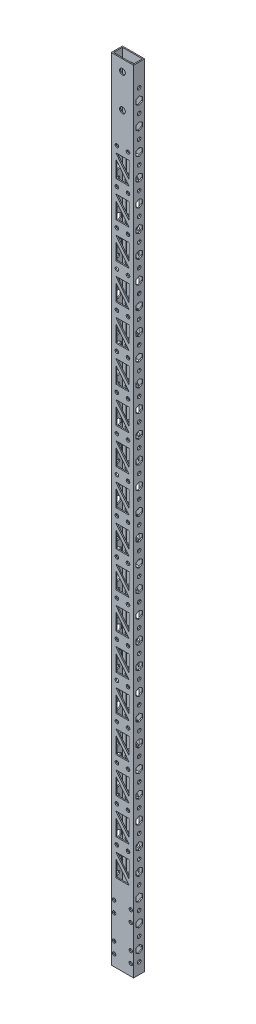
from build123d import *

# Parameters (mm, degrees)
SKETCH_1_W          = 20
SKETCH_1_H          = 10
SKETCH_1_W_2        = 18
SKETCH_1_H_2        = 8
EXTRUDE_1_DEPTH     = 710
SKETCH_2_R          = 1.55
SKETCH_2_R_2        = 2.6
CUT_EXTRUDE_1_DEPTH = 711.140831103
SKETCH_3_R          = 1.6
CUT_EXTRUDE_2_DEPTH = 711.299232718
SKETCH_6_R          = 1.6
CUT_EXTRUDE_4_DEPTH = 711.140831106


with BuildPart() as part:
    # 草图1 → 拉伸-薄壁1 (new body)
    with BuildSketch(Plane(origin=(0, 0, 0), x_dir=(1, 0, 0), z_dir=(0, 1, 0))):
        Rectangle(SKETCH_1_W, SKETCH_1_H)
        Rectangle(SKETCH_1_W_2, SKETCH_1_H_2, mode=Mode.SUBTRACT)
    extrude(amount=EXTRUDE_1_DEPTH)

    # 草图2 → 切除-拉伸1 (cut, through all)
    with BuildSketch(Plane(origin=(0, 0, -5), x_dir=(-1, 0, 0), z_dir=(0, 0, -1))):
        with Locations((-7.5, 20)):
            Circle(SKETCH_2_R)
        with Locations((-7.5, 10)):
            Circle(SKETCH_2_R)
        with Locations((7.5, 10)):
            Circle(SKETCH_2_R)
        with Locations((7.5, 20)):
            Circle(SKETCH_2_R)
        with Locations((-7.5, 51.9)):
            Circle(SKETCH_2_R)
        with Locations((-7.5, 41.9)):
            Circle(SKETCH_2_R)
        with Locations((7.5, 41.9)):
            Circle(SKETCH_2_R)
        with Locations((7.5, 51.9)):
            Circle(SKETCH_2_R)
        with Locations((0, 700)):
            Circle(SKETCH_2_R_2)
        with Locations((0, 670)):
            Circle(SKETCH_2_R_2)
    extrude(amount=-CUT_EXTRUDE_1_DEPTH, mode=Mode.SUBTRACT)

    # 草图3 → 切除-拉伸2 (cut, through all)
    with BuildSketch(Plane.ZY.offset(10)):
        with Locations((0, 10)):
            Circle(SKETCH_3_R)
        with Locations((0, 30)):
            Circle(SKETCH_3_R)
        with Locations((0, 50)):
            Circle(SKETCH_3_R)
        with Locations((0, 70)):
            Circle(SKETCH_3_R)
        with Locations((0, 90)):
            Circle(SKETCH_3_R)
        with Locations((0, 110)):
            Circle(SKETCH_3_R)
        with Locations((0, 130)):
            Circle(SKETCH_3_R)
        with Locations((0, 150)):
            Circle(SKETCH_3_R)
        with Locations((0, 170)):
            Circle(SKETCH_3_R)
        with Locations((0, 190)):
            Circle(SKETCH_3_R)
        with Locations((0, 210)):
            Circle(SKETCH_3_R)
        with Locations((0, 230)):
            Circle(SKETCH_3_R)
        with Locations((0, 250)):
            Circle(SKETCH_3_R)
        with Locations((0, 270)):
            Circle(SKETCH_3_R)
        with Locations((0, 290)):
            Circle(SKETCH_3_R)
        with Locations((0, 310)):
            Circle(SKETCH_3_R)
        with Locations((0, 330)):
            Circle(SKETCH_3_R)
        with Locations((0, 350)):
            Circle(SKETCH_3_R)
        with Locations((0, 370)):
            Circle(SKETCH_3_R)
        with Locations((0, 390)):
            Circle(SKETCH_3_R)
        with Locations((0, 410)):
            Circle(SKETCH_3_R)
        with Locations((0, 430)):
            Circle(SKETCH_3_R)
        with Locations((0, 450)):
            Circle(SKETCH_3_R)
        with Locations((0, 470)):
            Circle(SKETCH_3_R)
        with Locations((0, 490)):
            Circle(SKETCH_3_R)
        with Locations((0, 510)):
            Circle(SKETCH_3_R)
        with Locations((0, 530)):
            Circle(SKETCH_3_R)
        with Locations((0, 550)):
            Circle(SKETCH_3_R)
        with Locations((0, 570)):
            Circle(SKETCH_3_R)
        with Locations((0, 590)):
            Circle(SKETCH_3_R)
        with Locations((0, 610)):
            Circle(SKETCH_3_R)
        with Locations((0, 630)):
            Circle(SKETCH_3_R)
        with Locations((0, 650)):
            Circle(SKETCH_3_R)
        with Locations((0, 670)):
            Circle(SKETCH_3_R)
        with Locations((0, 690)):
            Circle(SKETCH_3_R)
        Polygon((-3.031088913, 681.75), (-3.031088913, 678.25), (0, 676.5), (3.031088913, 678.25), (3.031088913, 681.75), (0, 683.5), align=None)
        Polygon((3.031088913, 661.75), (0, 663.5), (-3.031088913, 661.75), (-3.031088913, 658.25), (0, 656.5), (3.031088913, 658.25), align=None)
        Polygon((3.031088913, 641.75), (0, 643.5), (-3.031088913, 641.75), (-3.031088913, 638.25), (0, 636.5), (3.031088913, 638.25), align=None)
        Polygon((3.031088913, 621.75), (0, 623.5), (-3.031088913, 621.75), (-3.031088913, 618.25), (0, 616.5), (3.031088913, 618.25), align=None)
        Polygon((3.031088913, 601.75), (0, 603.5), (-3.031088913, 601.75), (-3.031088913, 598.25), (0, 596.5), (3.031088913, 598.25), align=None)
        Polygon((3.031088913, 581.75), (0, 583.5), (-3.031088913, 581.75), (-3.031088913, 578.25), (0, 576.5), (3.031088913, 578.25), align=None)
        Polygon((3.031088913, 561.75), (0, 563.5), (-3.031088913, 561.75), (-3.031088913, 558.25), (0, 556.5), (3.031088913, 558.25), align=None)
        Polygon((3.031088913, 541.75), (0, 543.5), (-3.031088913, 541.75), (-3.031088913, 538.25), (0, 536.5), (3.031088913, 538.25), align=None)
        Polygon((3.031088913, 521.75), (0, 523.5), (-3.031088913, 521.75), (-3.031088913, 518.25), (0, 516.5), (3.031088913, 518.25), align=None)
        Polygon((3.031088913, 501.75), (0, 503.5), (-3.031088913, 501.75), (-3.031088913, 498.25), (0, 496.5), (3.031088913, 498.25), align=None)
        Polygon((3.031088913, 481.75), (0, 483.5), (-3.031088913, 481.75), (-3.031088913, 478.25), (0, 476.5), (3.031088913, 478.25), align=None)
        Polygon((3.031088913, 461.75), (0, 463.5), (-3.031088913, 461.75), (-3.031088913, 458.25), (0, 456.5), (3.031088913, 458.25), align=None)
        Polygon((3.031088913, 441.75), (0, 443.5), (-3.031088913, 441.75), (-3.031088913, 438.25), (0, 436.5), (3.031088913, 438.25), align=None)
        Polygon((3.031088913, 421.75), (0, 423.5), (-3.031088913, 421.75), (-3.031088913, 418.25), (0, 416.5), (3.031088913, 418.25), align=None)
        Polygon((3.031088913, 401.75), (0, 403.5), (-3.031088913, 401.75), (-3.031088913, 398.25), (0, 396.5), (3.031088913, 398.25), align=None)
        Polygon((3.031088913, 381.75), (0, 383.5), (-3.031088913, 381.75), (-3.031088913, 378.25), (0, 376.5), (3.031088913, 378.25), align=None)
        Polygon((3.031088913, 361.75), (0, 363.5), (-3.031088913, 361.75), (-3.031088913, 358.25), (0, 356.5), (3.031088913, 358.25), align=None)
        Polygon((3.031088913, 341.75), (0, 343.5), (-3.031088913, 341.75), (-3.031088913, 338.25), (0, 336.5), (3.031088913, 338.25), align=None)
        Polygon((3.031088913, 321.75), (0, 323.5), (-3.031088913, 321.75), (-3.031088913, 318.25), (0, 316.5), (3.031088913, 318.25), align=None)
        Polygon((3.031088913, 301.75), (0, 303.5), (-3.031088913, 301.75), (-3.031088913, 298.25), (0, 296.5), (3.031088913, 298.25), align=None)
        Polygon((3.031088913, 281.75), (0, 283.5), (-3.031088913, 281.75), (-3.031088913, 278.25), (0, 276.5), (3.031088913, 278.25), align=None)
        Polygon((3.031088913, 261.75), (0, 263.5), (-3.031088913, 261.75), (-3.031088913, 258.25), (0, 256.5), (3.031088913, 258.25), align=None)
        Polygon((3.031088913, 241.75), (0, 243.5), (-3.031088913, 241.75), (-3.031088913, 238.25), (0, 236.5), (3.031088913, 238.25), align=None)
        Polygon((3.031088913, 221.75), (0, 223.5), (-3.031088913, 221.75), (-3.031088913, 218.25), (0, 216.5), (3.031088913, 218.25), align=None)
        Polygon((3.031088913, 201.75), (0, 203.5), (-3.031088913, 201.75), (-3.031088913, 198.25), (0, 196.5), (3.031088913, 198.25), align=None)
        Polygon((3.031088913, 181.75), (0, 183.5), (-3.031088913, 181.75), (-3.031088913, 178.25), (0, 176.5), (3.031088913, 178.25), align=None)
        Polygon((3.031088913, 161.75), (0, 163.5), (-3.031088913, 161.75), (-3.031088913, 158.25), (0, 156.5), (3.031088913, 158.25), align=None)
        Polygon((3.031088913, 141.75), (0, 143.5), (-3.031088913, 141.75), (-3.031088913, 138.25), (0, 136.5), (3.031088913, 138.25), align=None)
        Polygon((3.031088913, 121.75), (0, 123.5), (-3.031088913, 121.75), (-3.031088913, 118.25), (0, 116.5), (3.031088913, 118.25), align=None)
        Polygon((3.031088913, 101.75), (0, 103.5), (-3.031088913, 101.75), (-3.031088913, 98.25), (0, 96.5), (3.031088913, 98.25), align=None)
        Polygon((3.031088913, 81.75), (0, 83.5), (-3.031088913, 81.75), (-3.031088913, 78.25), (0, 76.5), (3.031088913, 78.25), align=None)
        Polygon((3.031088913, 61.75), (0, 63.5), (-3.031088913, 61.75), (-3.031088913, 58.25), (0, 56.5), (3.031088913, 58.25), align=None)
        Polygon((3.031088913, 41.75), (0, 43.5), (-3.031088913, 41.75), (-3.031088913, 38.25), (0, 36.5), (3.031088913, 38.25), align=None)
        Polygon((3.031088913, 21.75), (0, 23.5), (-3.031088913, 21.75), (-3.031088913, 18.25), (0, 16.5), (3.031088913, 18.25), align=None)
    extrude(amount=-CUT_EXTRUDE_2_DEPTH, mode=Mode.SUBTRACT)

    # 草图6 → 切除-拉伸4 (cut, through all)
    with BuildSketch(Plane(origin=(0, 0, -5), x_dir=(-1, 0, 0), z_dir=(0, 0, -1))):
        with Locations((-5, 96)):
            Circle(SKETCH_6_R)
        with Locations((5, 96)):
            Circle(SKETCH_6_R)
        with Locations((-5, 128)):
            Circle(SKETCH_6_R)
        with Locations((5, 128)):
            Circle(SKETCH_6_R)
        with Locations((-5, 160)):
            Circle(SKETCH_6_R)
        with Locations((5, 160)):
            Circle(SKETCH_6_R)
        with Locations((-5, 192)):
            Circle(SKETCH_6_R)
        with Locations((5, 192)):
            Circle(SKETCH_6_R)
        with Locations((-5, 224)):
            Circle(SKETCH_6_R)
        with Locations((5, 224)):
            Circle(SKETCH_6_R)
        with Locations((-5, 256)):
            Circle(SKETCH_6_R)
        with Locations((5, 256)):
            Circle(SKETCH_6_R)
        with Locations((-5, 288)):
            Circle(SKETCH_6_R)
        with Locations((5, 288)):
            Circle(SKETCH_6_R)
        with Locations((-5, 320)):
            Circle(SKETCH_6_R)
        with Locations((5, 320)):
            Circle(SKETCH_6_R)
        with Locations((-5, 352)):
            Circle(SKETCH_6_R)
        with Locations((5, 352)):
            Circle(SKETCH_6_R)
        with Locations((-5, 384)):
            Circle(SKETCH_6_R)
        with Locations((5, 384)):
            Circle(SKETCH_6_R)
        with Locations((-5, 416)):
            Circle(SKETCH_6_R)
        with Locations((5, 416)):
            Circle(SKETCH_6_R)
        with Locations((-5, 448)):
            Circle(SKETCH_6_R)
        with Locations((5, 448)):
            Circle(SKETCH_6_R)
        with Locations((-5, 480)):
            Circle(SKETCH_6_R)
        with Locations((5, 480)):
            Circle(SKETCH_6_R)
        with Locations((-5, 512)):
            Circle(SKETCH_6_R)
        with Locations((5, 512)):
            Circle(SKETCH_6_R)
        with Locations((-5, 544)):
            Circle(SKETCH_6_R)
        with Locations((5, 544)):
            Circle(SKETCH_6_R)
        with Locations((-5, 576)):
            Circle(SKETCH_6_R)
        with Locations((5, 576)):
            Circle(SKETCH_6_R)
        with Locations((-5, 608)):
            Circle(SKETCH_6_R)
        with Locations((5, 608)):
            Circle(SKETCH_6_R)
        with Locations((-5, 640)):
            Circle(SKETCH_6_R)
        with Locations((5, 640)):
            Circle(SKETCH_6_R)
        Polygon((-6, 70), (6, 70), (6, 85), align=None)
        Polygon((-6, 75), (-6, 90), (6, 90), align=None)
        Polygon((6, 102), (6, 117), (-6, 102), align=None)
        Polygon((6, 122), (-6, 107), (-6, 122), align=None)
        Polygon((6, 134), (6, 149), (-6, 134), align=None)
        Polygon((6, 154), (-6, 139), (-6, 154), align=None)
        Polygon((6, 166), (6, 181), (-6, 166), align=None)
        Polygon((6, 186), (-6, 171), (-6, 186), align=None)
        Polygon((6, 198), (6, 213), (-6, 198), align=None)
        Polygon((6, 218), (-6, 203), (-6, 218), align=None)
        Polygon((6, 230), (6, 245), (-6, 230), align=None)
        Polygon((6, 250), (-6, 235), (-6, 250), align=None)
        Polygon((6, 262), (6, 277), (-6, 262), align=None)
        Polygon((6, 282), (-6, 267), (-6, 282), align=None)
        Polygon((6, 294), (6, 309), (-6, 294), align=None)
        Polygon((6, 314), (-6, 299), (-6, 314), align=None)
        Polygon((6, 326), (6, 341), (-6, 326), align=None)
        Polygon((6, 346), (-6, 331), (-6, 346), align=None)
        Polygon((6, 358), (6, 373), (-6, 358), align=None)
        Polygon((6, 378), (-6, 363), (-6, 378), align=None)
        Polygon((6, 390), (6, 405), (-6, 390), align=None)
        Polygon((6, 410), (-6, 395), (-6, 410), align=None)
        Polygon((6, 422), (6, 437), (-6, 422), align=None)
        Polygon((6, 442), (-6, 427), (-6, 442), align=None)
        Polygon((6, 454), (6, 469), (-6, 454), align=None)
        Polygon((6, 474), (-6, 459), (-6, 474), align=None)
        Polygon((6, 486), (6, 501), (-6, 486), align=None)
        Polygon((6, 506), (-6, 491), (-6, 506), align=None)
        Polygon((6, 518), (6, 533), (-6, 518), align=None)
        Polygon((6, 538), (-6, 523), (-6, 538), align=None)
        Polygon((6, 550), (6, 565), (-6, 550), align=None)
        Polygon((6, 570), (-6, 555), (-6, 570), align=None)
        Polygon((6, 582), (6, 597), (-6, 582), align=None)
        Polygon((6, 602), (-6, 587), (-6, 602), align=None)
        Polygon((6, 614), (6, 629), (-6, 614), align=None)
        Polygon((6, 634), (-6, 619), (-6, 634), align=None)
    extrude(amount=-CUT_EXTRUDE_4_DEPTH, mode=Mode.SUBTRACT)


solid = part.part
